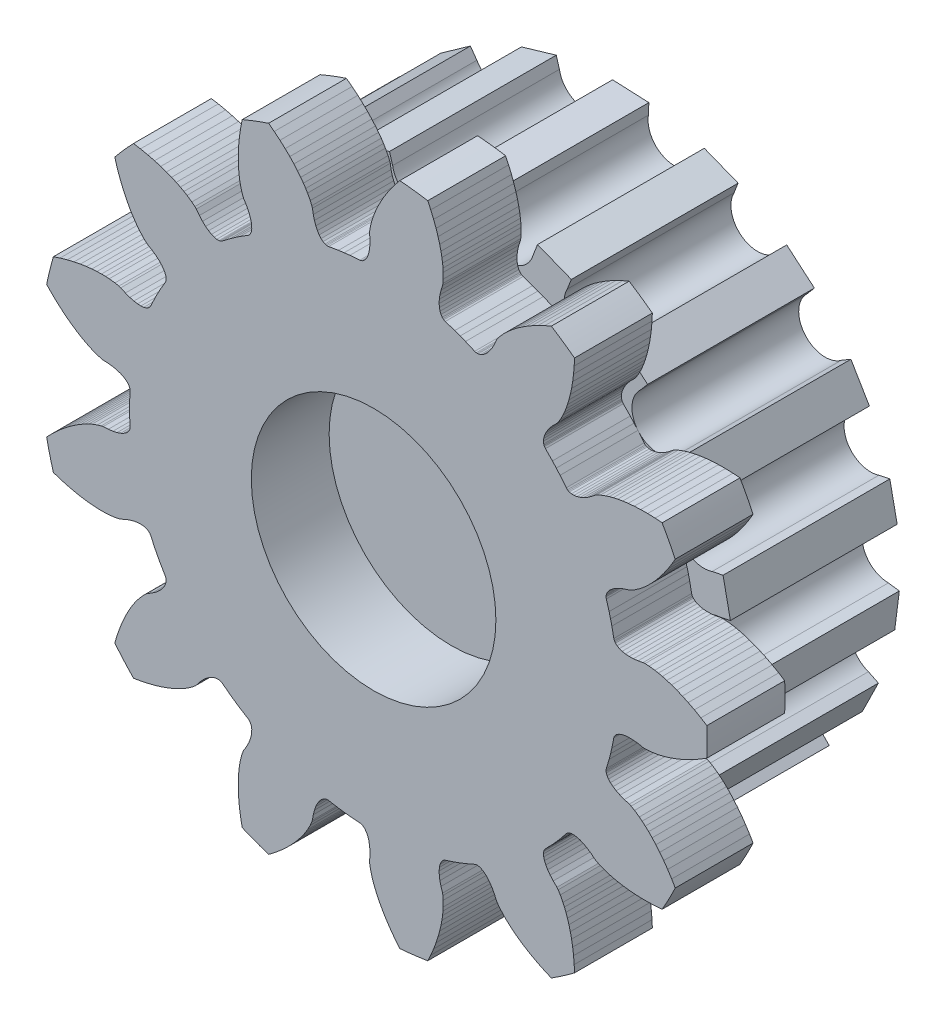
from build123d import *

# Parameters (mm, degrees)
MODEL_R             = 0.75
BOSS_EXTRUDE2_DEPTH = 7
SKETCH3_R           = 11
CUT_EXTRUDE1_DEPTH  = 113.282792588
BOSS_EXTRUDE3_DEPTH = 15


with BuildPart() as part:
    # Model → Boss-Extrude2 (new body)
    with BuildSketch(Plane.XY):
        with BuildLine():
            Line((55.1190207, -17.6838158), (54.9037463, -18.318159))
            Line((54.9037463, -18.318159), (54.724323631, -18.92713208))
            ThreePointArc((54.724323631, -18.92713208), (55.544759511, -19.893607211), (56.405295338, -20.824556888))
            Line((56.405295338, -20.824556888), (57.0314552, -20.719846))
            Line((57.0314552, -20.719846), (57.6871218, -20.5826028))
            Line((57.6871218, -20.5826028), (58.2944208, -20.4286814))
            Line((58.2944208, -20.4286814), (58.8525218, -20.2621016))
            Line((58.8525218, -20.2621016), (59.3647711, -20.0855498))
            Line((59.3647711, -20.0855498), (59.8292544, -19.9033306))
            Line((59.8292544, -19.9033306), (60.2448825, -19.7198564))
            Line((60.2448825, -19.7198564), (60.6155171, -19.5373309))
            Line((60.6155171, -19.5373309), (60.9397625, -19.3604166))
            Line((60.9397625, -19.3604166), (61.2189808, -19.1925447))
            Line((61.2189808, -19.1925447), (61.6494891, -18.8966781))
            Line((61.6494891, -18.8966781), (61.9241145, -18.6724392))
            Line((61.9241145, -18.6724392), (62.0542121, -18.5453089))
            Line((62.0542121, -18.5453089), (62.333578, -18.1781789))
            Line((62.333578, -18.1781789), (62.6138773, -17.866433))
            Line((62.6138773, -17.866433), (62.8909988, -17.6094085))
            Line((62.8909988, -17.6094085), (63.1608873, -17.4062382))
            Line((63.1608873, -17.4062382), (63.4195308, -17.2557811))
            Line((63.4195308, -17.2557811), (63.6630345, -17.1566733))
            Line((63.6630345, -17.1566733), (63.887594, -17.1072973))
            Line((63.887594, -17.1072973), (64.0894991, -17.1058455))
            Line((64.0894991, -17.1058455), (64.180835, -17.1224493))
            Line((64.180835, -17.1224493), (64.2651801, -17.1502548))
            Line((64.2651801, -17.1502548), (64.3946808, -17.2249523))
            Line((64.3946808, -17.2249523), (65.1083043, -17.7654177))
            Line((65.1083043, -17.7654177), (65.5309788, -18.0644959))
            Line((65.5309788, -18.0644959), (65.9605041, -18.3536488))
            Line((65.9605041, -18.3536488), (66.7189025, -18.8292467))
            Line((66.7189025, -18.8292467), (66.8346674, -18.9238439))
            Line((66.8346674, -18.9238439), (66.8905752, -18.9928479))
            Line((66.8905752, -18.9928479), (66.9384882, -19.0723607))
            Line((66.9384882, -19.0723607), (67.0087273, -19.2616601))
            Line((67.0087273, -19.2616601), (67.0421898, -19.4891358))
            Line((67.0421898, -19.4891358), (67.03587, -19.7519599))
            Line((67.03587, -19.7519599), (66.9869064, -20.0471485))
            Line((66.9869064, -20.0471485), (66.8926427, -20.3715438))
            Line((66.8926427, -20.3715438), (66.7505892, -20.7217991))
            Line((66.7505892, -20.7217991), (66.5584973, -21.0944301))
            Line((66.5584973, -21.0944301), (66.3142893, -21.4858279))
            Line((66.3142893, -21.4858279), (66.2415537, -21.6525523))
            Line((66.2415537, -21.6525523), (66.1292701, -21.9888476))
            Line((66.1292701, -21.9888476), (66.0052904, -22.4962956))
            Line((66.0052904, -22.4962956), (65.9473396, -22.8168975))
            Line((65.9473396, -22.8168975), (65.8969008, -23.1828069))
            Line((65.8969008, -23.1828069), (65.8576654, -23.5940807))
            Line((65.8576654, -23.5940807), (65.8334978, -24.0477606))
            Line((65.8334978, -24.0477606), (65.827828, -24.5466758))
            Line((65.827828, -24.5466758), (65.8443953, -25.0882433))
            Line((65.8443953, -25.0882433), (65.8865458, -25.6691468))
            Line((65.8865458, -25.6691468), (65.957978, -26.2915626))
            Line((65.957978, -26.2915626), (66.0621559, -26.9532886))
            Line((66.0621559, -26.9532886), (66.186288926, -27.575889293))
            ThreePointArc((66.186288926, -27.575889293), (67.36189219, -28.050384933), (68.55649269, -28.474788973))
            Line((68.55649269, -28.474788973), (69.0622682, -28.0910811))
            Line((69.0622682, -28.0910811), (69.579052, -27.6648548))
            Line((69.579052, -27.6648548), (70.0452578, -27.2463383))
            Line((70.0452578, -27.2463383), (70.4620182, -26.8394767))
            Line((70.4620182, -26.8394767), (70.8335447, -26.4450938))
            Line((70.8335447, -26.4450938), (71.1601427, -26.0678906))
            Line((71.1601427, -26.0678906), (71.4428984, -25.7122802))
            Line((71.4428984, -25.7122802), (71.6862553, -25.3784194))
            Line((71.6862553, -25.3784194), (71.8911442, -25.0710852))
            Line((71.8911442, -25.0710852), (72.0603657, -24.7926828))
            Line((72.0603657, -24.7926828), (72.3040658, -24.3306388))
            Line((72.3040658, -24.3306388), (72.4430254, -24.0044603))
            Line((72.4430254, -24.0044603), (72.4991408, -23.8314327))
            Line((72.4991408, -23.8314327), (72.5758931, -23.3765274))
            Line((72.5758931, -23.3765274), (72.6792104, -22.9702285))
            Line((72.6792104, -22.9702285), (72.8051441, -22.6138598))
            Line((72.8051441, -22.6138598), (72.9497005, -22.308538))
            Line((72.9497005, -22.308538), (73.108797, -22.0551173))
            Line((73.108797, -22.0551173), (73.2783512, -21.8541998))
            Line((73.2783512, -21.8541998), (73.4542425, -21.7061215))
            Line((73.4542425, -21.7061215), (73.632346, -21.611006))
            Line((73.632346, -21.611006), (73.720936, -21.5832621))
            Line((73.720936, -21.5832621), (73.8085418, -21.5686855))
            Line((73.8085418, -21.5686855), (73.9579226, -21.5746449))
            Line((73.9579226, -21.5746449), (74.8409717, -21.7215659))
            Line((74.8409717, -21.7215659), (75.3542199, -21.7899598))
            Line((75.3542199, -21.7899598), (75.8689217, -21.8463816))
            Line((75.8689217, -21.8463816), (76.7614715, -21.9150573))
            Line((76.7614715, -21.9150573), (76.9079377, -21.9450203))
            Line((76.9079377, -21.9450203), (76.9895094, -21.9801388))
            Line((76.9895094, -21.9801388), (77.0688857, -22.0282775))
            Line((77.0688857, -22.0282775), (77.2190512, -22.1632521))
            Line((77.2190512, -22.1632521), (77.3543939, -22.349121))
            Line((77.3543939, -22.349121), (77.4709385, -22.5847771))
            Line((77.4709385, -22.5847771), (77.5647644, -22.8689082))
            Line((77.5647644, -22.8689082), (77.632052, -23.1999525))
            Line((77.632052, -23.1999525), (77.6690417, -23.5761037))
            Line((77.6690417, -23.5761037), (77.672123, -23.9953217))
            Line((77.672123, -23.9953217), (77.6377791, -24.4553763))
            Line((77.6377791, -24.4553763), (77.6508556, -24.6368053))
            Line((77.6508556, -24.6368053), (77.7077177, -24.9867609))
            Line((77.7077177, -24.9867609), (77.833762, -25.4937))
            Line((77.833762, -25.4937), (77.9314402, -25.80451))
            Line((77.9314402, -25.80451), (78.0568255, -26.1519467))
            Line((78.0568255, -26.1519467), (78.2132127, -26.5343452))
            Line((78.2132127, -26.5343452), (78.4026489, -26.94729))
            Line((78.4026489, -26.94729), (78.629486, -27.3916924))
            Line((78.629486, -27.3916924), (78.8958345, -27.8635274))
            Line((78.8958345, -27.8635274), (79.2031163, -28.3583036))
            Line((79.2031163, -28.3583036), (79.5556174, -28.8762292))
            Line((79.5556174, -28.8762292), (79.9553818, -29.4137445))
            Line((79.9553818, -29.4137445), (80.354633081, -29.907342608))
            ThreePointArc((80.354633081, -29.907342608), (81.61608725, -29.781157591), (82.871083911, -29.601790205))
            Line((82.871083911, -29.601790205), (83.1406078, -29.0269881))
            Line((83.1406078, -29.0269881), (83.40012, -28.4094221))
            Line((83.40012, -28.4094221), (83.6184303, -27.8221874))
            Line((83.6184303, -27.8221874), (83.7983753, -27.2682512))
            Line((83.7983753, -27.2682512), (83.9440668, -26.7463855))
            Line((83.9440668, -26.7463855), (84.05796, -26.260611))
            Line((84.05796, -26.260611), (84.1430673, -25.8143305))
            Line((84.1430673, -25.8143305), (84.2033963, -25.4056179))
            Line((84.2033963, -25.4056179), (84.2419911, -25.0382703))
            Line((84.2419911, -25.0382703), (84.2624492, -24.713116))
            Line((84.2624492, -24.713116), (84.2635124, -24.1907433))
            Line((84.2635124, -24.1907433), (84.2349723, -23.8373488))
            Line((84.2349723, -23.8373488), (84.20425, -23.6580624))
            Line((84.20425, -23.6580624), (84.0608059, -23.2195952))
            Line((84.0608059, -23.2195952), (83.9634722, -22.8118215))
            Line((83.9634722, -22.8118215), (83.9093682, -22.4377484))
            Line((83.9093682, -22.4377484), (83.8954764, -22.1002206))
            Line((83.8954764, -22.1002206), (83.9185789, -21.8018918))
            Line((83.9185789, -21.8018918), (83.9753407, -21.5451926))
            Line((83.9753407, -21.5451926), (84.0622693, -21.332335))
            Line((84.0622693, -21.332335), (84.1757697, -21.1653456))
            Line((84.1757697, -21.1653456), (84.2413191, -21.0996097))
            Line((84.2413191, -21.0996097), (84.312116, -21.0459903))
            Line((84.312116, -21.0459903), (84.4471556, -20.9818463))
            Line((84.4471556, -20.9818463), (85.2973343, -20.7015651))
            Line((85.2973343, -20.7015651), (85.7835773, -20.5236065))
            Line((85.7835773, -20.5236065), (86.2655437, -20.3343717))
            Line((86.2655437, -20.3343717), (87.0877724, -19.9803925))
            Line((87.0877724, -19.9803925), (87.2313864, -19.9388571))
            Line((87.2313864, -19.9388571), (87.3199348, -19.9320447))
            Line((87.3199348, -19.9320447), (87.4125902, -19.9377815))
            Line((87.4125902, -19.9377815), (87.608281, -19.9875101))
            Line((87.608281, -19.9875101), (87.8144987, -20.089192))
            Line((87.8144987, -20.089192), (88.0272086, -20.2436941))
            Line((88.0272086, -20.2436941), (88.2423296, -20.4516767))
            Line((88.2423296, -20.4516767), (88.4557537, -20.7135317))
            Line((88.4557537, -20.7135317), (88.6633127, -21.0294071))
            Line((88.6633127, -21.0294071), (88.8608613, -21.3991742))
            Line((88.8608613, -21.3991742), (89.0442494, -21.8224928))
            Line((89.0442494, -21.8224928), (89.1401423, -21.9770632))
            Line((89.1401423, -21.9770632), (89.3531237, -22.2605083))
            Line((89.3531237, -22.2605083), (89.7003167, -22.6508049))
            Line((89.7003167, -22.6508049), (89.931247, -22.8806202))
            Line((89.931247, -22.8806202), (90.2037321, -23.1299907))
            Line((90.2037321, -23.1299907), (90.5199155, -23.395911))
            Line((90.5199155, -23.395911), (90.879558, -23.6735201))
            Line((90.879558, -23.6735201), (91.2869364, -23.9616024))
            Line((91.2869364, -23.9616024), (91.7420489, -24.2556132))
            Line((91.7420489, -24.2556132), (92.2440674, -24.5509148))
            Line((92.2440674, -24.5509148), (92.7968836, -24.8456997))
            Line((92.7968836, -24.8456997), (93.4006533, -25.1358661))
            Line((93.4006533, -25.1358661), (93.983559225, -25.387384246))
            ThreePointArc((93.983559225, -25.387384246), (95.041880291, -24.689425939), (96.069768437, -23.947377938))
            Line((96.069768437, -23.947377938), (96.0412962, -23.3131619))
            Line((96.0412962, -23.3131619), (95.9840855, -22.6457331))
            Line((95.9840855, -22.6457331), (95.9044882, -22.0243087))
            Line((95.9044882, -22.0243087), (95.8063946, -21.4501979))
            Line((95.8063946, -21.4501979), (95.6928749, -20.9204026))
            Line((95.6928749, -20.9204026), (95.5679716, -20.4373418))
            Line((95.5679716, -20.4373418), (95.4359335, -20.0026287))
            Line((95.4359335, -20.0026287), (95.2994139, -19.6126955))
            Line((95.2994139, -19.6126955), (95.162873, -19.2694895))
            Line((95.162873, -19.2694895), (95.0298811, -18.9720723))
            Line((95.0298811, -18.9720723), (94.7880637, -18.5090401))
            Line((94.7880637, -18.5090401), (94.5985622, -18.209388))
            Line((94.5985622, -18.209388), (94.4880404, -18.0649152))
            Line((94.4880404, -18.0649152), (94.157261, -17.7433335))
            Line((94.157261, -17.7433335), (93.8815744, -17.4275011))
            Line((93.8815744, -17.4275011), (93.6598272, -17.1214192))
            Line((93.6598272, -17.1214192), (93.4906698, -16.829009))
            Line((93.4906698, -16.829009), (93.3724857, -16.5541158))
            Line((93.3724857, -16.5541158), (93.3034516, -16.3004413))
            Line((93.3034516, -16.3004413), (93.2815032, -16.0715675))
            Line((93.2815032, -16.0715675), (93.304399, -15.8709595))
            Line((93.304399, -15.8709595), (93.3318911, -15.7822909))
            Line((93.3318911, -15.7822909), (93.3696606, -15.7019124))
            Line((93.3696606, -15.7019124), (93.459423, -15.5823596))
            Line((93.459423, -15.5823596), (94.0819656, -14.9390852))
            Line((94.0819656, -14.9390852), (94.4298109, -14.5555423))
            Line((94.4298109, -14.5555423), (94.7686292, -14.1640023))
            Line((94.7686292, -14.1640023), (95.3321742, -13.4684605))
            Line((95.3321742, -13.4684605), (95.4400356, -13.364942))
            Line((95.4400356, -13.364942), (95.5152755, -13.3177594))
            Line((95.5152755, -13.3177594), (95.5999838, -13.2797799))
            Line((95.5999838, -13.2797799), (95.7963694, -13.2328705))
            Line((95.7963694, -13.2328705), (96.02622, -13.2270712))
            Line((96.02622, -13.2270712), (96.286366, -13.2650248))
            Line((96.286366, -13.2650248), (96.5735005, -13.3492125))
            Line((96.5735005, -13.3492125), (96.8841683, -13.4818904))
            Line((96.8841683, -13.4818904), (97.2147472, -13.6651268))
            Line((97.2147472, -13.6651268), (97.5615072, -13.9007338))
            Line((97.5615072, -13.9007338), (97.9206152, -14.1903391))
            Line((97.9206152, -14.1903391), (98.0773567, -14.2826408))
            Line((98.0773567, -14.2826408), (98.3976658, -14.4346416))
            Line((98.3976658, -14.4346416), (98.8864698, -14.6188834))
            Line((98.8864698, -14.6188834), (99.1977489, -14.7150561))
            Line((99.1977489, -14.7150561), (99.5549107, -14.8092325))
            Line((99.5549107, -14.8092325), (99.9584566, -14.8977555))
            Line((99.9584566, -14.8977555), (100.4059156, -14.976432))
            Line((100.4059156, -14.976432), (100.9005097, -15.042198))
            Line((100.9005097, -15.042198), (101.4401255, -15.0910303))
            Line((101.4401255, -15.0910303), (102.0218743, -15.1192073))
            Line((102.0218743, -15.1192073), (102.6483621, -15.1233198))
            Line((102.6483621, -15.1233198), (103.3178207, -15.0996637))
            Line((103.3178207, -15.0996637), (103.950844382, -15.051482004))
            ThreePointArc((103.950844382, -15.051482004), (104.563583797, -13.941644289), (105.128886697, -12.80690997))
            Line((105.128886697, -12.80690997), (104.808941, -12.2585713))
            Line((104.808941, -12.2585713), (104.4481138, -11.6941795))
            Line((104.4481138, -11.6941795), (104.0888436, -11.1809263))
            Line((104.0888436, -11.1809263), (103.7351834, -10.7181628))
            Line((103.7351834, -10.7181628), (103.3884585, -10.3018076))
            Line((103.3884585, -10.3018076), (103.0533726, -9.932124))
            Line((103.0533726, -9.932124), (102.7344375, -9.6085658))
            Line((102.7344375, -9.6085658), (102.4323443, -9.3267409))
            Line((102.4323443, -9.3267409), (102.1519476, -9.0863008))
            Line((102.1519476, -9.0863008), (101.8959724, -8.8847554))
            Line((101.8959724, -8.8847554), (101.466672, -8.5871388))
            Line((101.466672, -8.5871388), (101.1596215, -8.4098759))
            Line((101.1596215, -8.4098759), (100.9946194, -8.3333136))
            Line((100.9946194, -8.3333136), (100.5522823, -8.202288))
            Line((100.5522823, -8.202288), (100.1613994, -8.0507502))
            Line((100.1613994, -8.0507502), (99.8228086, -7.8827792))
            Line((99.8228086, -7.8827792), (99.5371373, -7.7024742))
            Line((99.5371373, -7.7024742), (99.3047413, -7.5139912))
            Line((99.3047413, -7.5139912), (99.1257262, -7.3214554))
            Line((99.1257262, -7.3214554), (98.999929, -7.1289977))
            Line((98.999929, -7.1289977), (98.926975, -6.9407279))
            Line((98.926975, -6.9407279), (98.9101117, -6.8494395))
            Line((98.9101117, -6.8494395), (98.9062011, -6.7607155))
            Line((98.9062011, -6.7607155), (98.9301228, -6.6131421))
            Line((98.9301228, -6.6131421), (99.1824124, -5.7542409))
            Line((99.1824124, -5.7542409), (99.3121729, -5.2529788))
            Line((99.3121729, -5.2529788), (99.4302238, -4.7488306))
            Line((99.4302238, -4.7488306), (99.6059838, -3.8710665))
            Line((99.6059838, -3.8710665), (99.6533829, -3.7292798))
            Line((99.6533829, -3.7292798), (99.6980776, -3.6525359))
            Line((99.6980776, -3.6525359), (99.7554331, -3.5795409))
            Line((99.7554331, -3.5795409), (99.907524, -3.4467397))
            Line((99.907524, -3.4467397), (100.1083516, -3.3347877))
            Line((100.1083516, -3.3347877), (100.3563374, -3.2474981))
            Line((100.3563374, -3.2474981), (100.6497063, -3.1886046))
            Line((100.6497063, -3.1886046), (100.9864475, -3.1617105))
            Line((100.9864475, -3.1617105), (101.3643148, -3.1703306))
            Line((101.3643148, -3.1703306), (101.7808476, -3.2178028))
            Line((101.7808476, -3.2178028), (102.2334082, -3.3073498))
            Line((102.2334082, -3.3073498), (102.4150906, -3.3162375))
            Line((102.4150906, -3.3162375), (102.7693485, -3.3019724))
            Line((102.7693485, -3.3019724), (103.2877844, -3.2379519))
            Line((103.2877844, -3.2379519), (103.608102, -3.1784499))
            Line((103.608102, -3.1784499), (103.9681191, -3.0958577))
            Line((103.9681191, -3.0958577), (104.3665799, -2.9867038))
            Line((104.3665799, -2.9867038), (104.7993479, -2.8484238))
            Line((104.7993479, -2.8484238), (105.2678523, -2.6768073))
            Line((105.2678523, -2.6768073), (105.7683518, -2.4692742))
            Line((105.7683518, -2.4692742), (106.2965593, -2.2238715))
            Line((106.2965593, -2.2238715), (106.8531979, -1.9363696))
            Line((106.8531979, -1.9363696), (107.4349805, -1.6043102))
            Line((107.4349805, -1.6043102), (107.973104111, -1.267466597))
            ThreePointArc((107.973104111, -1.267466597), (107.9998906, 4.8e-08), (107.973104115, 1.267466692))
            Line((107.973104115, 1.267466692), (107.4349805, 1.6043102))
            Line((107.4349805, 1.6043102), (106.8531979, 1.9363696))
            Line((106.8531979, 1.9363696), (106.2965593, 2.2238715))
            Line((106.2965593, 2.2238715), (105.7683518, 2.4692742))
            Line((105.7683518, 2.4692742), (105.2678523, 2.6768073))
            Line((105.2678523, 2.6768073), (104.7993479, 2.8484238))
            Line((104.7993479, 2.8484238), (104.3665799, 2.9867038))
            Line((104.3665799, 2.9867038), (103.9681191, 3.0958577))
            Line((103.9681191, 3.0958577), (103.608102, 3.1784499))
            Line((103.608102, 3.1784499), (103.2877844, 3.2379519))
            Line((103.2877844, 3.2379519), (102.7693485, 3.3019724))
            Line((102.7693485, 3.3019724), (102.4150906, 3.3162375))
            Line((102.4150906, 3.3162375), (102.2334082, 3.3073498))
            Line((102.2334082, 3.3073498), (101.7808476, 3.2178028))
            Line((101.7808476, 3.2178028), (101.3643148, 3.1703306))
            Line((101.3643148, 3.1703306), (100.9864475, 3.1617105))
            Line((100.9864475, 3.1617105), (100.6497063, 3.1886046))
            Line((100.6497063, 3.1886046), (100.3563374, 3.2474981))
            Line((100.3563374, 3.2474981), (100.1083516, 3.3347877))
            Line((100.1083516, 3.3347877), (99.907524, 3.4467397))
            Line((99.907524, 3.4467397), (99.7554331, 3.5795409))
            Line((99.7554331, 3.5795409), (99.6980776, 3.6525359))
            Line((99.6980776, 3.6525359), (99.6533829, 3.7292798))
            Line((99.6533829, 3.7292798), (99.6059838, 3.8710665))
            Line((99.6059838, 3.8710665), (99.4302238, 4.7488306))
            Line((99.4302238, 4.7488306), (99.3121729, 5.2529788))
            Line((99.3121729, 5.2529788), (99.1824124, 5.7542409))
            Line((99.1824124, 5.7542409), (98.9301228, 6.6131421))
            Line((98.9301228, 6.6131421), (98.9062011, 6.7607155))
            Line((98.9062011, 6.7607155), (98.9101117, 6.8494395))
            Line((98.9101117, 6.8494395), (98.926975, 6.9407279))
            Line((98.926975, 6.9407279), (98.999929, 7.1289977))
            Line((98.999929, 7.1289977), (99.1257262, 7.3214554))
            Line((99.1257262, 7.3214554), (99.3047413, 7.5139912))
            Line((99.3047413, 7.5139912), (99.5371373, 7.7024742))
            Line((99.5371373, 7.7024742), (99.8228086, 7.8827792))
            Line((99.8228086, 7.8827792), (100.1613994, 8.0507502))
            Line((100.1613994, 8.0507502), (100.5522823, 8.202288))
            Line((100.5522823, 8.202288), (100.9946194, 8.3333136))
            Line((100.9946194, 8.3333136), (101.1596215, 8.4098759))
            Line((101.1596215, 8.4098759), (101.466672, 8.5871388))
            Line((101.466672, 8.5871388), (101.8959724, 8.8847554))
            Line((101.8959724, 8.8847554), (102.1519476, 9.0863008))
            Line((102.1519476, 9.0863008), (102.4323443, 9.3267409))
            Line((102.4323443, 9.3267409), (102.7344375, 9.6085658))
            Line((102.7344375, 9.6085658), (103.0533726, 9.932124))
            Line((103.0533726, 9.932124), (103.3884585, 10.3018076))
            Line((103.3884585, 10.3018076), (103.7351834, 10.7181628))
            Line((103.7351834, 10.7181628), (104.0888436, 11.1809263))
            Line((104.0888436, 11.1809263), (104.4481138, 11.6941795))
            Line((104.4481138, 11.6941795), (104.808941, 12.2585713))
            Line((104.808941, 12.2585713), (105.128886797, 12.80690997))
            ThreePointArc((105.128886797, 12.80690997), (104.563583897, 13.941644289), (103.950844482, 15.051482004))
            Line((103.950844482, 15.051482004), (103.3178207, 15.0996637))
            Line((103.3178207, 15.0996637), (102.6483621, 15.1233198))
            Line((102.6483621, 15.1233198), (102.0218743, 15.1192073))
            Line((102.0218743, 15.1192073), (101.4401255, 15.0910303))
            Line((101.4401255, 15.0910303), (100.9005097, 15.042198))
            Line((100.9005097, 15.042198), (100.4059156, 14.976432))
            Line((100.4059156, 14.976432), (99.9584566, 14.8977555))
            Line((99.9584566, 14.8977555), (99.5549107, 14.8092325))
            Line((99.5549107, 14.8092325), (99.1977489, 14.7150561))
            Line((99.1977489, 14.7150561), (98.8864698, 14.6188834))
            Line((98.8864698, 14.6188834), (98.3976658, 14.4346416))
            Line((98.3976658, 14.4346416), (98.0773567, 14.2826408))
            Line((98.0773567, 14.2826408), (97.9206152, 14.1903391))
            Line((97.9206152, 14.1903391), (97.5615072, 13.9007338))
            Line((97.5615072, 13.9007338), (97.2147472, 13.6651268))
            Line((97.2147472, 13.6651268), (96.8841683, 13.4818904))
            Line((96.8841683, 13.4818904), (96.5735005, 13.3492125))
            Line((96.5735005, 13.3492125), (96.286366, 13.2650248))
            Line((96.286366, 13.2650248), (96.02622, 13.2270712))
            Line((96.02622, 13.2270712), (95.7963694, 13.2328705))
            Line((95.7963694, 13.2328705), (95.5999838, 13.2797799))
            Line((95.5999838, 13.2797799), (95.5152755, 13.3177594))
            Line((95.5152755, 13.3177594), (95.4400356, 13.364942))
            Line((95.4400356, 13.364942), (95.3321742, 13.4684605))
            Line((95.3321742, 13.4684605), (94.7686292, 14.1640023))
            Line((94.7686292, 14.1640023), (94.4298109, 14.5555423))
            Line((94.4298109, 14.5555423), (94.0819656, 14.9390852))
            Line((94.0819656, 14.9390852), (93.459423, 15.5823596))
            Line((93.459423, 15.5823596), (93.3696606, 15.7019124))
            Line((93.3696606, 15.7019124), (93.3318911, 15.7822909))
            Line((93.3318911, 15.7822909), (93.304399, 15.8709595))
            Line((93.304399, 15.8709595), (93.2815032, 16.0715675))
            Line((93.2815032, 16.0715675), (93.3034516, 16.3004413))
            Line((93.3034516, 16.3004413), (93.3724857, 16.5541158))
            Line((93.3724857, 16.5541158), (93.4906698, 16.829009))
            Line((93.4906698, 16.829009), (93.6598272, 17.1214192))
            Line((93.6598272, 17.1214192), (93.8815744, 17.4275011))
            Line((93.8815744, 17.4275011), (94.157261, 17.7433335))
            Line((94.157261, 17.7433335), (94.4880404, 18.0649152))
            Line((94.4880404, 18.0649152), (94.5985622, 18.209388))
            Line((94.5985622, 18.209388), (94.7880637, 18.5090401))
            Line((94.7880637, 18.5090401), (95.0298811, 18.9720723))
            Line((95.0298811, 18.9720723), (95.162873, 19.2694895))
            Line((95.162873, 19.2694895), (95.2994139, 19.6126955))
            Line((95.2994139, 19.6126955), (95.4359335, 20.0026287))
            Line((95.4359335, 20.0026287), (95.5679716, 20.4373418))
            Line((95.5679716, 20.4373418), (95.6928749, 20.9204026))
            Line((95.6928749, 20.9204026), (95.8063946, 21.4501979))
            Line((95.8063946, 21.4501979), (95.9044882, 22.0243087))
            Line((95.9044882, 22.0243087), (95.9840855, 22.6457331))
            Line((95.9840855, 22.6457331), (96.0412962, 23.3131619))
            Line((96.0412962, 23.3131619), (96.069768437, 23.947377938))
            ThreePointArc((96.069768437, 23.947377938), (95.041880291, 24.689425939), (93.983559225, 25.387384246))
            Line((93.983559225, 25.387384246), (93.4006533, 25.1358661))
            Line((93.4006533, 25.1358661), (92.7968836, 24.8456997))
            Line((92.7968836, 24.8456997), (92.2440674, 24.5509148))
            Line((92.2440674, 24.5509148), (91.7420489, 24.2556132))
            Line((91.7420489, 24.2556132), (91.2869364, 23.9616024))
            Line((91.2869364, 23.9616024), (90.879558, 23.6735201))
            Line((90.879558, 23.6735201), (90.5199155, 23.395911))
            Line((90.5199155, 23.395911), (90.2037321, 23.1299907))
            Line((90.2037321, 23.1299907), (89.931247, 22.8806202))
            Line((89.931247, 22.8806202), (89.7003167, 22.6508049))
            Line((89.7003167, 22.6508049), (89.3531237, 22.2605083))
            Line((89.3531237, 22.2605083), (89.1401423, 21.9770632))
            Line((89.1401423, 21.9770632), (89.0442494, 21.8224928))
            Line((89.0442494, 21.8224928), (88.8608613, 21.3991742))
            Line((88.8608613, 21.3991742), (88.6633127, 21.0294071))
            Line((88.6633127, 21.0294071), (88.4557537, 20.7135317))
            Line((88.4557537, 20.7135317), (88.2423296, 20.4516767))
            Line((88.2423296, 20.4516767), (88.0272086, 20.2436941))
            Line((88.0272086, 20.2436941), (87.8144987, 20.089192))
            Line((87.8144987, 20.089192), (87.608281, 19.9875101))
            Line((87.608281, 19.9875101), (87.4125902, 19.9377815))
            Line((87.4125902, 19.9377815), (87.3199348, 19.9320447))
            Line((87.3199348, 19.9320447), (87.2313864, 19.9388571))
            Line((87.2313864, 19.9388571), (87.0877724, 19.9803925))
            Line((87.0877724, 19.9803925), (86.2655437, 20.3343717))
            Line((86.2655437, 20.3343717), (85.7835773, 20.5236065))
            Line((85.7835773, 20.5236065), (85.2973343, 20.7015651))
            Line((85.2973343, 20.7015651), (84.4471556, 20.9818463))
            Line((84.4471556, 20.9818463), (84.312116, 21.0459903))
            Line((84.312116, 21.0459903), (84.2413191, 21.0996097))
            Line((84.2413191, 21.0996097), (84.1757697, 21.1653456))
            Line((84.1757697, 21.1653456), (84.0622693, 21.332335))
            Line((84.0622693, 21.332335), (83.9753407, 21.5451926))
            Line((83.9753407, 21.5451926), (83.9185789, 21.8018918))
            Line((83.9185789, 21.8018918), (83.8954764, 22.1002206))
            Line((83.8954764, 22.1002206), (83.9093682, 22.4377484))
            Line((83.9093682, 22.4377484), (83.9634722, 22.8118215))
            Line((83.9634722, 22.8118215), (84.0608059, 23.2195952))
            Line((84.0608059, 23.2195952), (84.20425, 23.6580624))
            Line((84.20425, 23.6580624), (84.2349723, 23.8373488))
            Line((84.2349723, 23.8373488), (84.2635124, 24.1907433))
            Line((84.2635124, 24.1907433), (84.2624492, 24.713116))
            Line((84.2624492, 24.713116), (84.2419911, 25.0382703))
            Line((84.2419911, 25.0382703), (84.2033963, 25.4056179))
            Line((84.2033963, 25.4056179), (84.1430673, 25.8143305))
            Line((84.1430673, 25.8143305), (84.05796, 26.260611))
            Line((84.05796, 26.260611), (83.9440668, 26.7463855))
            Line((83.9440668, 26.7463855), (83.7983753, 27.2682512))
            Line((83.7983753, 27.2682512), (83.6184303, 27.8221874))
            Line((83.6184303, 27.8221874), (83.40012, 28.4094221))
            Line((83.40012, 28.4094221), (83.1406078, 29.0269881))
            Line((83.1406078, 29.0269881), (82.871083911, 29.601790205))
            ThreePointArc((82.871083911, 29.601790205), (81.61608725, 29.781157591), (80.354633081, 29.907342608))
            Line((80.354633081, 29.907342608), (79.9553818, 29.4137445))
            Line((79.9553818, 29.4137445), (79.5556174, 28.8762292))
            Line((79.5556174, 28.8762292), (79.2031163, 28.3583036))
            Line((79.2031163, 28.3583036), (78.8958345, 27.8635274))
            Line((78.8958345, 27.8635274), (78.629486, 27.3916924))
            Line((78.629486, 27.3916924), (78.4026489, 26.94729))
            Line((78.4026489, 26.94729), (78.2132127, 26.5343452))
            Line((78.2132127, 26.5343452), (78.0568255, 26.1519467))
            Line((78.0568255, 26.1519467), (77.9314402, 25.80451))
            Line((77.9314402, 25.80451), (77.833762, 25.4937))
            Line((77.833762, 25.4937), (77.7077177, 24.9867609))
            Line((77.7077177, 24.9867609), (77.6508556, 24.6368053))
            Line((77.6508556, 24.6368053), (77.6377791, 24.4553763))
            Line((77.6377791, 24.4553763), (77.672123, 23.9953217))
            Line((77.672123, 23.9953217), (77.6690417, 23.5761037))
            Line((77.6690417, 23.5761037), (77.632052, 23.1999525))
            Line((77.632052, 23.1999525), (77.5647644, 22.8689082))
            Line((77.5647644, 22.8689082), (77.4709385, 22.5847771))
            Line((77.4709385, 22.5847771), (77.3543939, 22.349121))
            Line((77.3543939, 22.349121), (77.2190512, 22.1632521))
            Line((77.2190512, 22.1632521), (77.0688857, 22.0282775))
            Line((77.0688857, 22.0282775), (76.9895094, 21.9801388))
            Line((76.9895094, 21.9801388), (76.9079377, 21.9450203))
            Line((76.9079377, 21.9450203), (76.7614715, 21.9150573))
            Line((76.7614715, 21.9150573), (75.8689217, 21.8463816))
            Line((75.8689217, 21.8463816), (75.3542199, 21.7899598))
            Line((75.3542199, 21.7899598), (74.8409717, 21.7215659))
            Line((74.8409717, 21.7215659), (73.9579226, 21.5746449))
            Line((73.9579226, 21.5746449), (73.8085418, 21.5686855))
            Line((73.8085418, 21.5686855), (73.720936, 21.5832621))
            Line((73.720936, 21.5832621), (73.632346, 21.611006))
            Line((73.632346, 21.611006), (73.4542425, 21.7061215))
            Line((73.4542425, 21.7061215), (73.2783512, 21.8541998))
            Line((73.2783512, 21.8541998), (73.108797, 22.0551173))
            Line((73.108797, 22.0551173), (72.9497005, 22.308538))
            Line((72.9497005, 22.308538), (72.8051441, 22.6138598))
            Line((72.8051441, 22.6138598), (72.6792104, 22.9702285))
            Line((72.6792104, 22.9702285), (72.5758931, 23.3765274))
            Line((72.5758931, 23.3765274), (72.4991408, 23.8314327))
            Line((72.4991408, 23.8314327), (72.4430254, 24.0044603))
            Line((72.4430254, 24.0044603), (72.3040658, 24.3306388))
            Line((72.3040658, 24.3306388), (72.0603657, 24.7926828))
            Line((72.0603657, 24.7926828), (71.8911442, 25.0710852))
            Line((71.8911442, 25.0710852), (71.6862553, 25.3784194))
            Line((71.6862553, 25.3784194), (71.4428984, 25.7122802))
            Line((71.4428984, 25.7122802), (71.1601427, 26.0678906))
            Line((71.1601427, 26.0678906), (70.8335447, 26.4450938))
            Line((70.8335447, 26.4450938), (70.4620182, 26.8394767))
            Line((70.4620182, 26.8394767), (70.0452578, 27.2463383))
            Line((70.0452578, 27.2463383), (69.579052, 27.6648548))
            Line((69.579052, 27.6648548), (69.0622682, 28.0910811))
            Line((69.0622682, 28.0910811), (68.55649274, 28.474788957))
            ThreePointArc((68.55649274, 28.474788957), (67.361892216, 28.050384905), (66.18628893, 27.575889252))
            Line((66.18628893, 27.575889252), (66.0621559, 26.9532886))
            Line((66.0621559, 26.9532886), (65.957978, 26.2915626))
            Line((65.957978, 26.2915626), (65.8865458, 25.6691468))
            Line((65.8865458, 25.6691468), (65.8443953, 25.0882433))
            Line((65.8443953, 25.0882433), (65.827828, 24.5466758))
            Line((65.827828, 24.5466758), (65.8334978, 24.0477606))
            Line((65.8334978, 24.0477606), (65.8576654, 23.5940807))
            Line((65.8576654, 23.5940807), (65.8969008, 23.1828069))
            Line((65.8969008, 23.1828069), (65.9473396, 22.8168975))
            Line((65.9473396, 22.8168975), (66.0052904, 22.4962956))
            Line((66.0052904, 22.4962956), (66.1292701, 21.9888476))
            Line((66.1292701, 21.9888476), (66.2415537, 21.6525523))
            Line((66.2415537, 21.6525523), (66.3142893, 21.4858279))
            Line((66.3142893, 21.4858279), (66.5584973, 21.0944301))
            Line((66.5584973, 21.0944301), (66.7505892, 20.7217991))
            Line((66.7505892, 20.7217991), (66.8926427, 20.3715438))
            Line((66.8926427, 20.3715438), (66.9869064, 20.0471485))
            Line((66.9869064, 20.0471485), (67.03587, 19.7519599))
            Line((67.03587, 19.7519599), (67.0421898, 19.4891358))
            Line((67.0421898, 19.4891358), (67.0087273, 19.2616601))
            Line((67.0087273, 19.2616601), (66.9384882, 19.0723607))
            Line((66.9384882, 19.0723607), (66.8905752, 18.9928479))
            Line((66.8905752, 18.9928479), (66.8346674, 18.9238439))
            Line((66.8346674, 18.9238439), (66.7189025, 18.8292467))
            Line((66.7189025, 18.8292467), (65.9605041, 18.3536488))
            Line((65.9605041, 18.3536488), (65.5309788, 18.0644959))
            Line((65.5309788, 18.0644959), (65.1083043, 17.7654177))
            Line((65.1083043, 17.7654177), (64.3946808, 17.2249523))
            Line((64.3946808, 17.2249523), (64.2651801, 17.1502548))
            Line((64.2651801, 17.1502548), (64.180835, 17.1224493))
            Line((64.180835, 17.1224493), (64.0894991, 17.1058455))
            Line((64.0894991, 17.1058455), (63.887594, 17.1072973))
            Line((63.887594, 17.1072973), (63.6630345, 17.1566733))
            Line((63.6630345, 17.1566733), (63.4195308, 17.2557811))
            Line((63.4195308, 17.2557811), (63.1608873, 17.4062382))
            Line((63.1608873, 17.4062382), (62.8909988, 17.6094085))
            Line((62.8909988, 17.6094085), (62.6138773, 17.866433))
            Line((62.6138773, 17.866433), (62.333578, 18.1781789))
            Line((62.333578, 18.1781789), (62.0542121, 18.5453089))
            Line((62.0542121, 18.5453089), (61.9241145, 18.6724392))
            Line((61.9241145, 18.6724392), (61.6494891, 18.8966781))
            Line((61.6494891, 18.8966781), (61.2189808, 19.1925447))
            Line((61.2189808, 19.1925447), (60.9397625, 19.3604166))
            Line((60.9397625, 19.3604166), (60.6155171, 19.5373309))
            Line((60.6155171, 19.5373309), (60.2448825, 19.7198564))
            Line((60.2448825, 19.7198564), (59.8292544, 19.9033306))
            Line((59.8292544, 19.9033306), (59.3647711, 20.0855498))
            Line((59.3647711, 20.0855498), (58.8525218, 20.2621016))
            Line((58.8525218, 20.2621016), (58.2944208, 20.4286814))
            Line((58.2944208, 20.4286814), (57.6871218, 20.5826028))
            Line((57.6871218, 20.5826028), (57.0314552, 20.719846))
            Line((57.0314552, 20.719846), (56.405295338, 20.824556788))
            ThreePointArc((56.405295338, 20.824556788), (55.544759511, 19.893607111), (54.724323631, 18.92713198))
            Line((54.724323631, 18.92713198), (54.9037463, 18.318159))
            Line((54.9037463, 18.318159), (55.1190207, 17.6838158))
            Line((55.1190207, 17.6838158), (55.3450216, 17.0994979))
            Line((55.3450216, 17.0994979), (55.5776585, 16.565545))
            Line((55.5776585, 16.565545), (55.8146679, 16.0783116))
            Line((55.8146679, 16.0783116), (56.0515457, 15.639179))
            Line((56.0515457, 15.639179), (56.2837806, 15.2486967))
            Line((56.2837806, 15.2486967), (56.5096504, 14.9027654))
            Line((56.5096504, 14.9027654), (56.7243582, 14.6022088))
            Line((56.7243582, 14.6022088), (56.9246623, 14.345261))
            Line((56.9246623, 14.345261), (57.2702637, 13.9535544))
            Line((57.2702637, 13.9535544), (57.5259701, 13.7079604))
            Line((57.5259701, 13.7079604), (57.6678549, 13.5941352))
            Line((57.6678549, 13.5941352), (58.065982, 13.3610589))
            Line((58.065982, 13.3610589), (58.4092413, 13.12038))
            Line((58.4092413, 13.12038), (58.6977951, 12.8762599))
            Line((58.6977951, 12.8762599), (58.9320155, 12.6328287))
            Line((58.9320155, 12.6328287), (59.1125516, 12.3942066))
            Line((59.1125516, 12.3942066), (59.2402879, 12.1644244))
            Line((59.2402879, 12.1644244), (59.3163716, 11.9474539))
            Line((59.3163716, 11.9474539), (59.3421498, 11.7471958))
            Line((59.3421498, 11.7471958), (59.3366763, 11.6545245))
            Line((59.3366763, 11.6545245), (59.3192402, 11.5674428))
            Line((59.3192402, 11.5674428), (59.260697, 11.4298825))
            Line((59.260697, 11.4298825), (58.81019, 10.6563162))
            Line((58.81019, 10.6563162), (58.5642402, 10.2006736))
            Line((58.5642402, 10.2006736), (58.3289691, 9.7394265))
            Line((58.3289691, 9.7394265), (57.9482537, 8.9292307))
            Line((57.9482537, 8.9292307), (57.8683001, 8.8029074))
            Line((57.8683001, 8.8029074), (57.8065381, 8.7390897))
            Line((57.8065381, 8.7390897), (57.7333804, 8.6819419))
            Line((57.7333804, 8.6819419), (57.5539276, 8.5893973))
            Line((57.5539276, 8.5893973), (57.3321439, 8.5287597))
            Line((57.3321439, 8.5287597), (57.0704743, 8.5033535))
            Line((57.0704743, 8.5033535), (56.771536, 8.516379))
            Line((56.771536, 8.516379), (56.4381437, 8.5708539))
            Line((56.4381437, 8.5708539), (56.0733195, 8.669653))
            Line((56.0733195, 8.669653), (55.6802512, 8.8154287))
            Line((55.6802512, 8.8154287), (55.2622712, 9.0106784))
            Line((55.2622712, 9.0106784), (55.0879951, 9.0627872))
            Line((55.0879951, 9.0627872), (54.7406174, 9.1337162))
            Line((54.7406174, 9.1337162), (54.2219252, 9.1956259))
            Line((54.2219252, 9.1956259), (53.8966757, 9.2145099))
            Line((53.8966757, 9.2145099), (53.5273545, 9.2204754))
            Line((53.5273545, 9.2204754), (53.11435, 9.2098512))
            Line((53.11435, 9.2098512), (52.6610649, 9.1791575))
            Line((52.6610649, 9.1791575), (52.1651039, 9.1246484))
            Line((52.1651039, 9.1246484), (51.629482, 9.0429231))
            Line((51.629482, 9.0429231), (51.0578946, 8.9310598))
            Line((51.0578946, 8.9310598), (50.4486272, 8.7851245))
            Line((50.4486272, 8.7851245), (49.8042831, 8.6019438))
            Line((49.8042831, 8.6019438), (49.201184451, 8.403669694))
            ThreePointArc((49.201184451, 8.403669694), (48.871851727, 7.179443721), (48.594535246, 5.942396896))
            Line((48.594535246, 5.942396896), (49.03641, 5.48656))
            Line((49.03641, 5.48656), (49.52182, 5.02492))
            Line((49.52182, 5.02492), (49.99348, 4.61256))
            Line((49.99348, 4.61256), (50.44761, 4.24788))
            Line((50.44761, 4.24788), (50.8839, 3.9266))
            Line((50.8839, 3.9266), (51.29772, 3.64785))
            Line((51.29772, 3.64785), (51.68482, 3.41002))
            Line((51.68482, 3.41002), (52.04558, 3.20868))
            Line((52.04558, 3.20868), (52.37537, 3.04233))
            Line((52.37537, 3.04233), (52.67214, 2.9079))
            Line((52.67214, 2.9079), (53.16019, 2.72167))
            Line((53.16019, 2.72167), (53.50074, 2.62304))
            Line((53.50074, 2.62304), (53.67927, 2.58819))
            Line((53.67927, 2.58819), (54.14011, 2.56683))
            Line((54.14011, 2.56683), (54.5559, 2.51324))
            Line((54.5559, 2.51324), (54.92485, 2.43118))
            Line((54.92485, 2.43118), (55.24537, 2.32448))
            Line((55.24537, 2.32448), (55.51612, 2.19709))
            Line((55.51612, 2.19709), (55.73601, 2.05299))
            Line((55.73601, 2.05299), (55.90421, 1.89623))
            Line((55.90421, 1.89623), (56.0201, 1.73089))
            Line((56.0201, 1.73089), (56.05832, 1.64629))
            Line((56.05832, 1.64629), (56.08335, 1.56108))
            Line((56.08335, 1.56108), (56.09544, 1.41207))
            Line((56.09544, 1.41207), (56.05603, 0.51775))
            Line((56.05603, 0.51775), (56.05, 0))
            Line((56.05, 0), (56.05603, -0.51775))
            Line((56.05603, -0.51775), (56.09544, -1.41207))
            Line((56.09544, -1.41207), (56.08335, -1.56108))
            Line((56.08335, -1.56108), (56.05832, -1.64629))
            Line((56.05832, -1.64629), (56.0201, -1.73089))
            Line((56.0201, -1.73089), (55.90421, -1.89623))
            Line((55.90421, -1.89623), (55.73601, -2.05299))
            Line((55.73601, -2.05299), (55.51612, -2.19709))
            Line((55.51612, -2.19709), (55.24537, -2.32448))
            Line((55.24537, -2.32448), (54.92485, -2.43118))
            Line((54.92485, -2.43118), (54.5559, -2.51324))
            Line((54.5559, -2.51324), (54.14011, -2.56683))
            Line((54.14011, -2.56683), (53.67927, -2.58819))
            Line((53.67927, -2.58819), (53.50074, -2.62304))
            Line((53.50074, -2.62304), (53.16019, -2.72167))
            Line((53.16019, -2.72167), (52.67214, -2.9079))
            Line((52.67214, -2.9079), (52.37537, -3.04233))
            Line((52.37537, -3.04233), (52.04558, -3.20868))
            Line((52.04558, -3.20868), (51.68482, -3.41002))
            Line((51.68482, -3.41002), (51.29772, -3.64785))
            Line((51.29772, -3.64785), (50.8839, -3.9266))
            Line((50.8839, -3.9266), (50.44761, -4.24788))
            Line((50.44761, -4.24788), (49.99348, -4.61256))
            Line((49.99348, -4.61256), (49.52182, -5.02492))
            Line((49.52182, -5.02492), (49.03641, -5.48656))
            Line((49.03641, -5.48656), (48.594535325, -5.942396893))
            ThreePointArc((48.594535325, -5.942396893), (48.871851802, -7.179443719), (49.201184522, -8.403669694))
            Line((49.201184522, -8.403669694), (49.8042831, -8.6019438))
            Line((49.8042831, -8.6019438), (50.4486272, -8.7851245))
            Line((50.4486272, -8.7851245), (51.0578946, -8.9310598))
            Line((51.0578946, -8.9310598), (51.629482, -9.0429231))
            Line((51.629482, -9.0429231), (52.1651039, -9.1246484))
            Line((52.1651039, -9.1246484), (52.6610649, -9.1791575))
            Line((52.6610649, -9.1791575), (53.11435, -9.2098512))
            Line((53.11435, -9.2098512), (53.5273545, -9.2204754))
            Line((53.5273545, -9.2204754), (53.8966757, -9.2145099))
            Line((53.8966757, -9.2145099), (54.2219252, -9.1956259))
            Line((54.2219252, -9.1956259), (54.7406174, -9.1337162))
            Line((54.7406174, -9.1337162), (55.0879951, -9.0627872))
            Line((55.0879951, -9.0627872), (55.2622712, -9.0106784))
            Line((55.2622712, -9.0106784), (55.6802512, -8.8154287))
            Line((55.6802512, -8.8154287), (56.0733195, -8.669653))
            Line((56.0733195, -8.669653), (56.4381437, -8.5708539))
            Line((56.4381437, -8.5708539), (56.771536, -8.516379))
            Line((56.771536, -8.516379), (57.0704743, -8.5033535))
            Line((57.0704743, -8.5033535), (57.3321439, -8.5287597))
            Line((57.3321439, -8.5287597), (57.5539276, -8.5893973))
            Line((57.5539276, -8.5893973), (57.7333804, -8.6819419))
            Line((57.7333804, -8.6819419), (57.8065381, -8.7390897))
            Line((57.8065381, -8.7390897), (57.8683001, -8.8029074))
            Line((57.8683001, -8.8029074), (57.9482537, -8.9292307))
            Line((57.9482537, -8.9292307), (58.3289691, -9.7394265))
            Line((58.3289691, -9.7394265), (58.5642402, -10.2006736))
            Line((58.5642402, -10.2006736), (58.81019, -10.6563162))
            Line((58.81019, -10.6563162), (59.260697, -11.4298825))
            Line((59.260697, -11.4298825), (59.3192402, -11.5674428))
            Line((59.3192402, -11.5674428), (59.3366763, -11.6545245))
            Line((59.3366763, -11.6545245), (59.3421498, -11.7471958))
            Line((59.3421498, -11.7471958), (59.3163716, -11.9474539))
            Line((59.3163716, -11.9474539), (59.2402879, -12.1644244))
            Line((59.2402879, -12.1644244), (59.1125516, -12.3942066))
            Line((59.1125516, -12.3942066), (58.9320155, -12.6328287))
            Line((58.9320155, -12.6328287), (58.6977951, -12.8762599))
            Line((58.6977951, -12.8762599), (58.4092413, -13.12038))
            Line((58.4092413, -13.12038), (58.065982, -13.3610589))
            Line((58.065982, -13.3610589), (57.6678549, -13.5941352))
            Line((57.6678549, -13.5941352), (57.5259701, -13.7079604))
            Line((57.5259701, -13.7079604), (57.2702637, -13.9535544))
            Line((57.2702637, -13.9535544), (56.9246623, -14.345261))
            Line((56.9246623, -14.345261), (56.7243582, -14.6022088))
            Line((56.7243582, -14.6022088), (56.5096504, -14.9027654))
            Line((56.5096504, -14.9027654), (56.2837806, -15.2486967))
            Line((56.2837806, -15.2486967), (56.0515457, -15.639179))
            Line((56.0515457, -15.639179), (55.8146679, -16.0783116))
            Line((55.8146679, -16.0783116), (55.5776585, -16.565545))
            Line((55.5776585, -16.565545), (55.3450216, -17.0994979))
            Line((55.3450216, -17.0994979), (55.1190207, -17.6838158))
        make_face()
        with Locations((78, 0)):
            Circle(MODEL_R, mode=Mode.SUBTRACT)
    extrude(amount=BOSS_EXTRUDE2_DEPTH)

    # Sketch3 → Cut-Extrude1 (cut, through all)
    with BuildSketch(Plane(origin=(0, 0, 0), x_dir=(-1, 0, 0), z_dir=(0, 0, -1))):
        with Locations((-78, 0)):
            Circle(SKETCH3_R)
    extrude(amount=-CUT_EXTRUDE1_DEPTH, mode=Mode.SUBTRACT)

    # Sketch4 → Boss-Extrude3 (add)
    with BuildSketch(Plane(origin=(0, 0, 0), x_dir=(-1, 0, 0), z_dir=(0, 0, -1))):
        with BuildLine():
            ThreePointArc((-72.712877864, 23.75667473), (-75.3542199, 21.7899598), (-77.448143654, 24.331640086))
            Line((-77.448143654, 24.331640086), (-77.492645449, 25.33064939))
            Line((-77.492645449, 25.33064939), (-80.757630195, 25.185207621))
            Line((-80.757630195, 25.185207621), (-80.7131284, 24.186198316))
            ThreePointArc((-80.7131284, 24.186198316), (-80.690040918, 23.995672804), (-80.682328484, 23.803908571))
            ThreePointArc((-80.682328484, 23.803908571), (-82.761927452, 21.435996739), (-85.378515374, 23.192472175))
            Line((-85.378515374, 23.192472175), (-85.74498373, 24.12290269))
            Line((-85.74498373, 24.12290269), (-88.785837731, 22.925202543))
            Line((-88.785837731, 22.925202543), (-88.419369375, 21.994772027))
            ThreePointArc((-88.419369375, 21.994772027), (-88.208464545, 21.448761867), (-88.136726134, 20.867847464))
            ThreePointArc((-88.136726134, 20.867847464), (-89.830784414, 18.582975132), (-92.509310464, 19.540040035))
            Line((-92.509310464, 19.540040035), (-93.158032848, 20.301065178))
            Line((-93.158032848, 20.301065178), (-95.645232389, 18.180896048))
            Line((-95.645232389, 18.180896048), (-94.996510005, 17.419870905))
            ThreePointArc((-94.996510005, 17.419870905), (-94.432829644, 16.624650028), (-94.233886474, 15.670431286))
            ThreePointArc((-94.233886474, 15.670431286), (-95.561330191, 13.530923815), (-98.067796629, 13.770141362))
            Line((-98.067796629, 13.770141362), (-98.928473905, 14.279292251))
            Line((-98.928473905, 14.279292251), (-100.592492324, 11.466407362))
            Line((-100.592492324, 11.466407362), (-99.731815048, 10.957256473))
            ThreePointArc((-99.731815048, 10.957256473), (-98.698944472, 10.076375208), (-98.313087575, 8.774880727))
            ThreePointArc((-98.313087575, 8.774880727), (-99.302843144, 6.839098303), (-101.451625646, 6.508034208))
            Line((-101.451625646, 6.508034208), (-102.430990076, 6.710136442))
            Line((-102.430990076, 6.710136442), (-103.091505157, 3.509355517))
            Line((-103.091505157, 3.509355517), (-102.112140727, 3.307253283))
            ThreePointArc((-102.112140727, 3.307253283), (-100.559665774, 2.541704528), (-99.932284703, 0.928435684))
            ThreePointArc((-99.932284703, 0.928435684), (-100.62248979, -0.750818594), (-102.294107135, -1.459319436))
            Line((-102.294107135, -1.459319436), (-103.286029387, -1.586166769))
            Line((-103.286029387, -1.586166769), (-102.871464071, -4.82798945))
            Line((-102.871464071, -4.82798945), (-101.879541819, -4.701142117))
            ThreePointArc((-101.879541819, -4.701142117), (-99.832940268, -5.137582333), (-98.916012723, -7.018619771))
            ThreePointArc((-98.916012723, -7.018619771), (-99.352975952, -8.395540224), (-100.503945154, -9.268533175))
            Line((-100.503945154, -9.268533175), (-101.40093506, -9.710584199))
            Line((-101.40093506, -9.710584199), (-99.956213933, -12.642146847))
            Line((-99.956213933, -12.642146847), (-99.059224026, -12.200095824))
            ThreePointArc((-99.059224026, -12.200095824), (-96.620998719, -12.107602634), (-95.374400474, -14.205098869))
            ThreePointArc((-95.374400474, -14.205098869), (-95.611338246, -15.242126696), (-96.27513153, -16.073357529))
            Line((-96.27513153, -16.073357529), (-96.979986317, -16.782709155))
            Line((-96.979986317, -16.782709155), (-94.661667329, -19.08633147))
            Line((-94.661667329, -19.08633147), (-93.956812543, -18.376979844))
            ThreePointArc((-93.956812543, -18.376979844), (-91.29863721, -17.595494288), (-89.691236597, -19.85223509))
            ThreePointArc((-89.691236597, -19.85223509), (-89.786821486, -20.521082875), (-90.065923838, -21.13638419))
            Line((-90.065923838, -21.13638419), (-90.502261551, -22.036167164))
            Line((-90.502261551, -22.036167164), (-87.561570538, -23.462215923))
            Line((-87.561570538, -23.462215923), (-87.125232825, -22.562432949))
            ThreePointArc((-87.125232825, -22.562432949), (-84.471872982, -20.993646237), (-82.482380082, -23.348073599))
            ThreePointArc((-82.482380082, -23.348073599), (-82.499140399, -23.630496919), (-82.549186075, -23.90895566))
            Line((-82.549186075, -23.90895566), (-82.669722754, -24.901664534))
            Line((-82.669722754, -24.901664534), (-79.425329216, -25.295605227))
            Line((-79.425329216, -25.295605227), (-79.304792538, -24.302896353))
            ThreePointArc((-79.304792538, -24.302896353), (-77.023185602, -21.928254241), (-74.539473413, -24.090620798))
            Line((-74.539473413, -24.090620798), (-74.331147038, -25.068680163))
            Line((-74.331147038, -25.068680163), (-71.134631357, -24.387823203))
            Line((-71.134631357, -24.387823203), (-71.342957733, -23.409763838))
            ThreePointArc((-71.342957733, -23.409763838), (-69.956019588, -20.422949825), (-66.904762503, -21.661693368))
            Line((-66.904762503, -21.661693368), (-66.390148469, -22.519115316))
            Line((-66.390148469, -22.519115316), (-63.587902718, -20.837242119))
            Line((-63.587902718, -20.837242119), (-64.102516753, -19.979820172))
            ThreePointArc((-64.102516753, -19.979820172), (-63.760543667, -16.704501901), (-60.472392736, -16.885385346))
            Line((-60.472392736, -16.885385346), (-59.707257458, -17.529254904))
            Line((-59.707257458, -17.529254904), (-57.602948446, -15.028622528))
            Line((-57.602948446, -15.028622528), (-58.368083724, -14.384752971))
            ThreePointArc((-58.368083724, -14.384752971), (-59.108133787, -11.175861999), (-55.939411185, -10.279283818))
            Line((-55.939411185, -10.279283818), (-55.006668943, -10.639827728))
            Line((-55.006668943, -10.639827728), (-53.828331203, -7.591418493))
            Line((-53.828331203, -7.591418493), (-54.761073444, -7.230874583))
            ThreePointArc((-54.761073444, -7.230874583), (-56.502950749, -4.436144038), (-53.797036737, -2.559262389))
            Line((-53.797036737, -2.559262389), (-52.797764626, -2.597410125))
            Line((-52.797764626, -2.597410125), (-52.673089336, 0.668433529))
            Line((-52.673089336, 0.668433529), (-53.672361446, 0.706581264))
            ThreePointArc((-53.672361446, 0.706581264), (-56.227306558, 2.784298964), (-54.277428906, 5.438094831))
            Line((-54.277428906, 5.438094831), (-53.319913565, 5.726477169))
            Line((-53.319913565, 5.726477169), (-54.262411227, 8.855850406))
            Line((-54.262411227, 8.855850406), (-55.219926567, 8.567468068))
            ThreePointArc((-55.219926567, 8.567468068), (-58.31107154, 9.70301997), (-57.328529747, 12.846150096))
            Line((-57.328529747, 12.846150096), (-56.516532821, 13.429811806))
            Line((-56.516532821, 13.429811806), (-58.424069188, 16.083598478))
            Line((-58.424069188, 16.083598478), (-59.236066114, 15.499936769))
            ThreePointArc((-59.236066114, 15.499936769), (-62.528437426, 15.570268204), (-62.619705141, 18.862125669))
            Line((-62.619705141, 18.862125669), (-62.041219095, 19.677817948))
            Line((-62.041219095, 19.677817948), (-64.707083004, 21.568439093))
            Line((-64.707083004, 21.568439093), (-65.28556905, 20.752746814))
            ThreePointArc((-65.28556905, 20.752746814), (-68.422387183, 19.750236281), (-69.577574133, 22.83409725))
            Line((-69.577574133, 22.83409725), (-69.295286907, 23.793427184))
            Line((-69.295286907, 23.793427184), (-72.430590638, 24.716004664))
            Line((-72.430590638, 24.716004664), (-72.712877864, 23.75667473))
        make_face()
    extrude(amount=BOSS_EXTRUDE3_DEPTH)


solid = part.part
